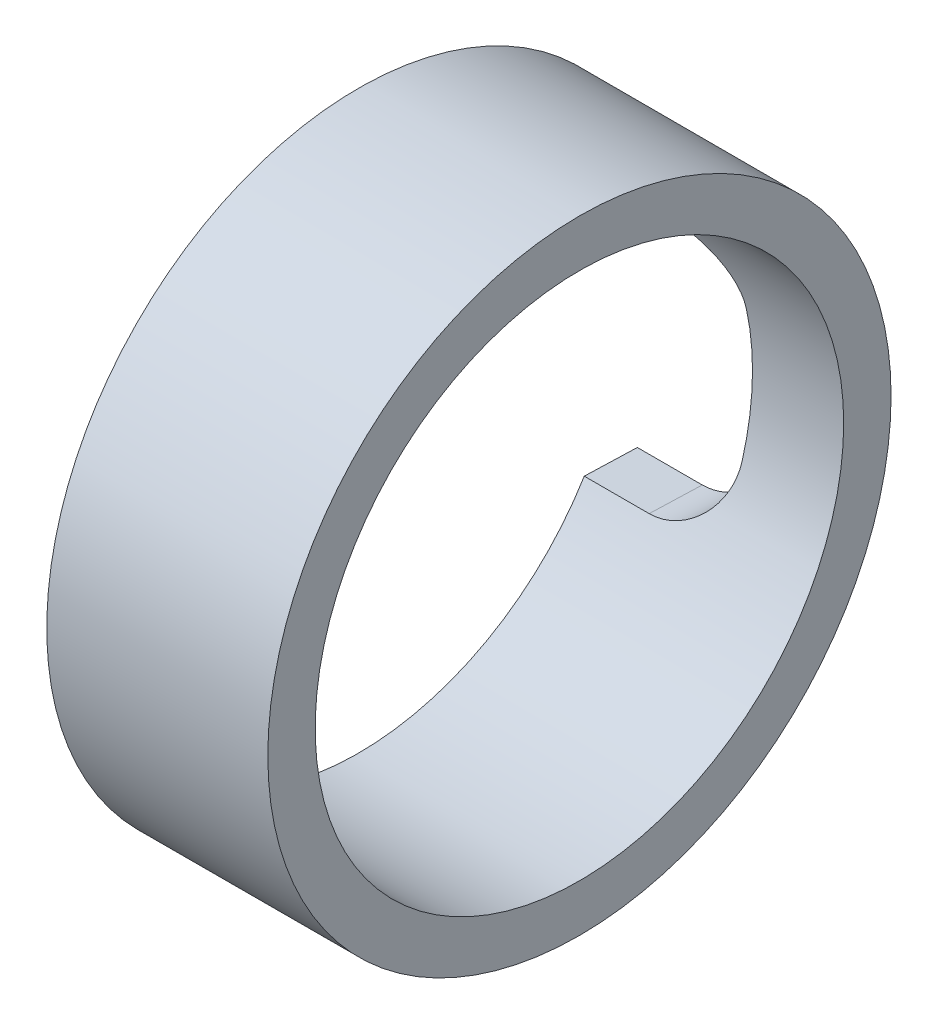
from build123d import *

# Parameters (mm, degrees)
SKETCH1_W          = 6.485999982
SKETCH1_H          = 1.390000014
CUT_EXTRUDE1_REACH = 43.1


with BuildPart() as part:
    # Sketch1 → Revolve1 (revolve)
    with BuildSketch(Plane.XY):
        with Locations((-35.769999961, 8.448999993)):
            Rectangle(SKETCH1_W, SKETCH1_H)
    revolve(axis=Axis((0, 0, 0), (-1, 0, 0)))

    # Sketch3 → Cut-Extrude1 (cut, up to next)
    with BuildSketch(Plane(origin=(0, 0, 0), x_dir=(1, 0, 0), z_dir=(0, -0.03230281229794047, -0.9994781279836213)), mode=Mode.PRIVATE) as cut_extrude1_sk1:
        with BuildLine():
            Line((-39.012999952, 3.81), (-39.012999952, -3.81))
            Line((-39.012999952, -3.81), (-37.107999952, -3.81))
            ThreePointArc((-37.107999952, -3.81), (-35.760961534, -3.252038418), (-35.202999952, -1.905))
            Line((-35.202999952, -1.905), (-35.202999952, 1.905))
            ThreePointArc((-35.202999952, 1.905), (-35.760961534, 3.252038418), (-37.107999952, 3.81))
            Line((-37.107999952, 3.81), (-39.012999952, 3.81))
        make_face()
    cut_extrude1_tool1 = extrude(cut_extrude1_sk1.sketch, amount=CUT_EXTRUDE1_REACH, mode=Mode.PRIVATE) & part.part
    add(cut_extrude1_tool1.solids().sort_by_distance((-37.191875, 0, 0))[0], mode=Mode.SUBTRACT)


solid = part.part
